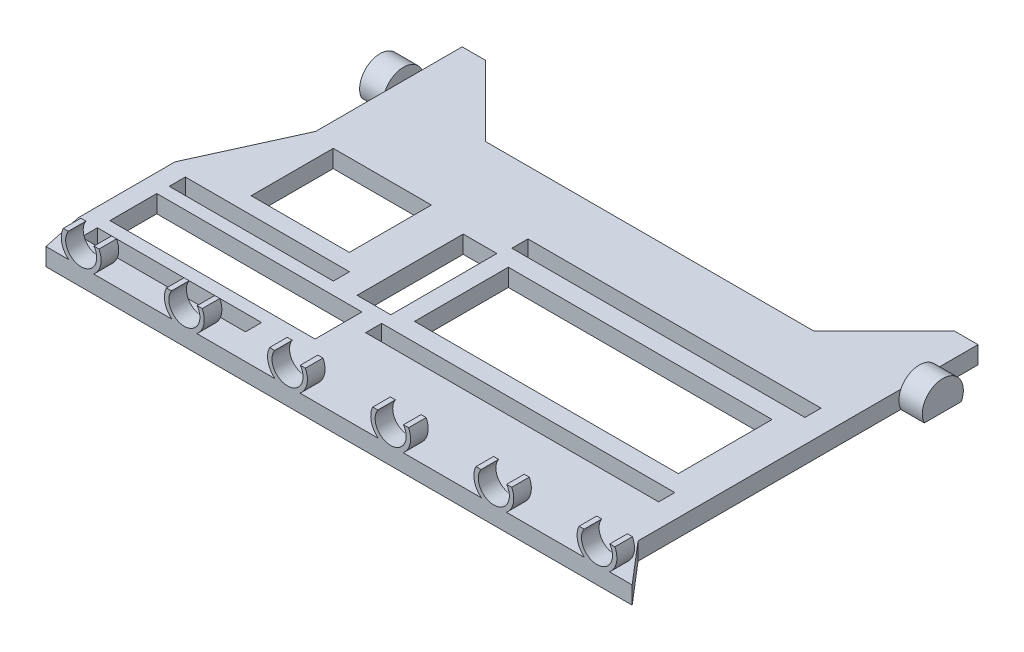
from build123d import *

# Parameters (mm, degrees)
SKETCH1_W            = 88
SKETCH1_H            = 65
SKETCH1_W_2          = 7.5
SKETCH1_H_2          = 33
BOSS_EXTRUDE1_DEPTH  = 3
BOSS_EXTRUDE8_DEPTH  = 4
CUT_EXTRUDE18_DEPTH  = 61.971304726
SKETCH8_W            = 16
SKETCH8_H            = 45
SKETCH8_W_2          = 2.75
SKETCH8_H_2          = 50
SKETCH8_W_3          = 18.1
SKETCH8_H_3          = 4.25
SKETCH8_H_4          = 1.5
CUT_EXTRUDE19_DEPTH  = 64.044492712
SKETCH10_W           = 16.75
SKETCH10_H           = 14
CUT_EXTRUDE21_DEPTH  = 61.971304726
BOSS_EXTRUDE10_DEPTH = 3
BOSS_EXTRUDE9_START  = -3
BOSS_EXTRUDE9_DEPTH  = 3
SKETCH16_W           = 35
SKETCH16_H           = 8
CUT_EXTRUDE22_DEPTH  = 3
SKETCH17_W           = 28
SKETCH17_H           = 2.75
CUT_EXTRUDE23_DEPTH  = 3
CUT_EXTRUDE24_DEPTH  = 3


# Read off the part's stored shape, not the designer's step: Boss-Extrude9
with BuildPart() as part:
    # Sketch1 → Boss-Extrude1 (new body)
    with BuildSketch(Plane(origin=(0, 0, 0), x_dir=(1, 0, 0), z_dir=(0, 1, 0))):
        Rectangle(SKETCH1_W, SKETCH1_H)
        with Locations((-47.75, -9)):
            Rectangle(SKETCH1_W_2, SKETCH1_H_2)
        with Locations((47.75, -9)):
            Rectangle(SKETCH1_W_2, SKETCH1_H_2)
    extrude(amount=BOSS_EXTRUDE1_DEPTH)

    # Sketch2 → Boss-Extrude8 (add)
    with BuildSketch(Plane.ZY.offset(44)):
        with BuildLine():
            ThreePointArc((-19, 1.5), (-23.268774411, 4.914525722), (-25.66227766, 0))
            Line((-25.66227766, 0), (-19.33772234, 0))
            ThreePointArc((-19.33772234, 0), (-19.085474278, 0.731225589), (-19, 1.5))
        make_face()
    boss_extrude8 = extrude(amount=BOSS_EXTRUDE8_DEPTH)

    # Sketch7 → Cut-Extrude18 (cut, through all)
    with BuildSketch(Plane(origin=(0, 3, 0), x_dir=(1, 0, 0), z_dir=(0, 1, 0))):
        Polygon((-40, 32.5), (-28, 20.5), (0, 20.5), (0, 32.5), align=None)
    cut_extrude18 = extrude(amount=-CUT_EXTRUDE18_DEPTH, mode=Mode.SUBTRACT)

    # Mirror4: Cut-Extrude18 across plane
    add(cut_extrude18.mirror(Plane(origin=(0, 0, 0), x_dir=(0, 0, 1), z_dir=(1, 0, 0))), mode=Mode.SUBTRACT)

    # Mirror5: Boss-Extrude8 across plane
    add(boss_extrude8.mirror(Plane(origin=(0, 0, 0), x_dir=(0, 0, 1), z_dir=(1, 0, 0))))

    # Sketch8 → Cut-Extrude19 (cut, through all)
    with BuildSketch(Plane(origin=(1.47526487, 3, -1.547457662), x_dir=(0, 0, -1), z_dir=(0, 1, 0))):
        with Locations((-5.672457662, -13.52473513)):
            Rectangle(SKETCH8_W, SKETCH8_H)
        with Locations((6.802542338, -13.521195307)):
            Rectangle(SKETCH8_W_2, SKETCH8_H_2)
        with Locations((-18.147457662, -13.521195307)):
            Rectangle(SKETCH8_W_2, SKETCH8_H_2)
        with Locations((-5.672457662, 15.60026487)):
            Rectangle(SKETCH8_W_3, SKETCH8_H_3)
        with Locations((-5.672457662, 12.72526487)):
            Rectangle(SKETCH8_W_3, SKETCH8_H_4)
    extrude(amount=-CUT_EXTRUDE19_DEPTH, mode=Mode.SUBTRACT)

    # Sketch10 → Cut-Extrude21 (cut, through all)
    with BuildSketch(Plane(origin=(0, 3, 0), x_dir=(1, 0, 0), z_dir=(0, 1, 0))):
        with Locations((-31.625, -0.5)):
            Rectangle(SKETCH10_W, SKETCH10_H)
    extrude(amount=-CUT_EXTRUDE21_DEPTH, mode=Mode.SUBTRACT)

    # Sketch15 → Boss-Extrude10 (add)
    with BuildSketch(Plane.XY.offset(32.5)):
        with BuildLine():
            Line((-46.184605227, 7.15), (-47.05122926, 7.15))
            ThreePointArc((-47.05122926, 7.15), (-46.886173938, 3.852779924), (-44, 2.25))
            Line((-44, 2.25), (-44, 3))
            ThreePointArc((-44, 3), (-46.344941364, 4.41559731), (-46.184605227, 7.15))
        make_face()
        with BuildLine():
            ThreePointArc((-40.6, 5.65), (-40.688340334, 6.42000666), (-40.94877074, 7.15))
            Line((-40.94877074, 7.15), (-41.815394773, 7.15))
            ThreePointArc((-41.815394773, 7.15), (-41.469021548, 6.435269427), (-41.35, 5.65))
            ThreePointArc((-41.35, 5.65), (-42.12616703, 3.77616703), (-44, 3))
            Line((-44, 3), (-41.86985916, 3))
            ThreePointArc((-41.86985916, 3), (-40.933855935, 4.180727877), (-40.6, 5.65))
        make_face()
        with BuildLine():
            ThreePointArc((-29.45122926, 7.15), (-29.719227927, 4.913300625), (-28.53014084, 3))
            Line((-28.53014084, 3), (-26.4, 3))
            ThreePointArc((-26.4, 3), (-28.744941364, 4.41559731), (-28.584605227, 7.15))
            Line((-28.584605227, 7.15), (-29.45122926, 7.15))
        make_face()
        with BuildLine():
            Line((-26.4, 3), (-24.26985916, 3))
            ThreePointArc((-24.26985916, 3), (-23.333855935, 4.180727877), (-23, 5.65))
            ThreePointArc((-23, 5.65), (-23.088340334, 6.42000666), (-23.34877074, 7.15))
            Line((-23.34877074, 7.15), (-24.215394773, 7.15))
            ThreePointArc((-24.215394773, 7.15), (-23.869021548, 6.435269427), (-23.75, 5.65))
            ThreePointArc((-23.75, 5.65), (-24.52616703, 3.77616703), (-26.4, 3))
        make_face()
        with BuildLine():
            Line((-8.8, 3), (-6.66985916, 3))
            ThreePointArc((-6.66985916, 3), (-5.733855935, 4.180727877), (-5.4, 5.65))
            ThreePointArc((-5.4, 5.65), (-5.488340334, 6.42000666), (-5.74877074, 7.15))
            Line((-5.74877074, 7.15), (-6.615394773, 7.15))
            ThreePointArc((-6.615394773, 7.15), (-6.269021548, 6.435269427), (-6.15, 5.65))
            ThreePointArc((-6.15, 5.65), (-6.92616703, 3.77616703), (-8.8, 3))
        make_face()
        with BuildLine():
            ThreePointArc((-11.85122926, 7.15), (-12.119227927, 4.913300625), (-10.93014084, 3))
            Line((-10.93014084, 3), (-8.8, 3))
            ThreePointArc((-8.8, 3), (-11.144941364, 4.41559731), (-10.984605227, 7.15))
            Line((-10.984605227, 7.15), (-11.85122926, 7.15))
        make_face()
        with BuildLine():
            Line((8.800000027, 3), (10.93014084, 3))
            ThreePointArc((10.93014084, 3), (11.866144065, 4.180727877), (12.2, 5.65))
            ThreePointArc((12.2, 5.65), (12.111659666, 6.42000666), (11.85122926, 7.15))
            Line((11.85122926, 7.15), (10.984605227, 7.15))
            ThreePointArc((10.984605227, 7.15), (11.330978452, 6.435269427), (11.45, 5.65))
            ThreePointArc((11.45, 5.65), (10.67383298, 3.77616704), (8.800000027, 3))
        make_face()
        with BuildLine():
            ThreePointArc((5.74877074, 7.15), (5.480772073, 4.913300625), (6.66985916, 3))
            Line((6.66985916, 3), (8.800000027, 3))
            ThreePointArc((8.800000027, 3), (6.455058643, 4.415597298), (6.615394773, 7.15))
            Line((6.615394773, 7.15), (5.74877074, 7.15))
        make_face()
        with BuildLine():
            Line((26.4, 3), (28.53014084, 3))
            ThreePointArc((28.53014084, 3), (29.466144065, 4.180727877), (29.8, 5.65))
            ThreePointArc((29.8, 5.65), (29.711659666, 6.42000666), (29.45122926, 7.15))
            Line((29.45122926, 7.15), (28.584605227, 7.15))
            ThreePointArc((28.584605227, 7.15), (28.930978452, 6.435269427), (29.05, 5.65))
            ThreePointArc((29.05, 5.65), (28.27383297, 3.77616703), (26.4, 3))
        make_face()
        with BuildLine():
            ThreePointArc((23.34877074, 7.15), (23.080772073, 4.913300625), (24.26985916, 3))
            Line((24.26985916, 3), (26.4, 3))
            ThreePointArc((26.4, 3), (24.055058636, 4.41559731), (24.215394773, 7.15))
            Line((24.215394773, 7.15), (23.34877074, 7.15))
        make_face()
        with BuildLine():
            ThreePointArc((40.94877074, 7.15), (40.680772073, 4.913300625), (41.86985916, 3))
            Line((41.86985916, 3), (44, 3))
            ThreePointArc((44, 3), (41.655058636, 4.41559731), (41.815394773, 7.15))
            Line((41.815394773, 7.15), (40.94877074, 7.15))
        make_face()
        with BuildLine():
            ThreePointArc((47.4, 5.65), (47.311659666, 6.42000666), (47.05122926, 7.15))
            Line((47.05122926, 7.15), (46.184605227, 7.15))
            ThreePointArc((46.184605227, 7.15), (46.530978452, 6.435269427), (46.65, 5.65))
            ThreePointArc((46.65, 5.65), (45.87383297, 3.77616703), (44, 3))
            Line((44, 3), (44, 2.25))
            ThreePointArc((44, 2.25), (46.404163056, 3.245836944), (47.4, 5.65))
        make_face()
    extrude(amount=-BOSS_EXTRUDE10_DEPTH)

    # Boss-Extrude9 outline → Boss-Extrude9 (add)
    with BuildSketch(Plane(origin=(0, 3, 0), x_dir=(1, 0, 0), z_dir=(0, 1, 0)).offset(BOSS_EXTRUDE9_START)):
        Polygon((-50, -32.5), (-44, -32.5), (-44, -29.5), (-44, -25.5), (-51.5, -25.5), align=None)
        Polygon((44, -32.5), (50, -32.5), (51.5, -25.5), (44, -25.5), (44, -29.5), align=None)
    extrude(amount=BOSS_EXTRUDE9_DEPTH)

    # Sketch16 → Cut-Extrude22 (cut)
    with BuildSketch(Plane(origin=(0, 3, 0), x_dir=(1, 0, 0), z_dir=(0, 1, 0))):
        with Locations((-30.875, -19.225)):
            Rectangle(SKETCH16_W, SKETCH16_H)
    extrude(amount=-CUT_EXTRUDE22_DEPTH, mode=Mode.SUBTRACT)

    # Sketch17 → Cut-Extrude23 (cut)
    with BuildSketch(Plane(origin=(0, 3, 0), x_dir=(1, 0, 0), z_dir=(0, 1, 0))):
        with Locations((-34.375, -11.725)):
            Rectangle(SKETCH17_W, SKETCH17_H)
        with Locations((-34.375, -26.725)):
            Rectangle(SKETCH17_W, SKETCH17_H)
    extrude(amount=-CUT_EXTRUDE23_DEPTH, mode=Mode.SUBTRACT)

    # Sketch19 → Cut-Extrude24 (cut)
    with BuildSketch(Plane(origin=(0, 3, 0), x_dir=(1, 0, 0), z_dir=(0, 1, 0))):
        Polygon((50, -32.5), (51.5, -25.5), (51.5, 7.5), (44, 7.5), (44, -25.5), align=None)
        Polygon((-51.5, -9), (-44, 7.5), (-51.5, 7.5), align=None)
    extrude(amount=-CUT_EXTRUDE24_DEPTH, mode=Mode.SUBTRACT)


solid = part.part
